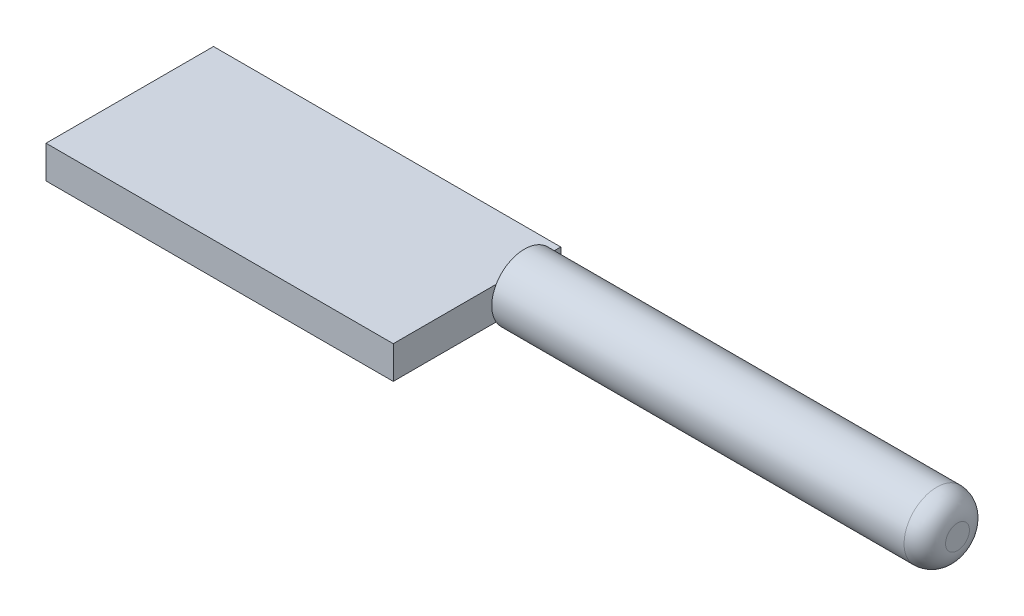
from build123d import *

# Parameters (mm, degrees)
SKETCH1_W           = 42.5
SKETCH1_H           = 20.5
BOSS_EXTRUDE1_DEPTH = 4
SKETCH2_R           = 4
BOSS_EXTRUDE2_DEPTH = 53
FILLET1_R           = 2.54


with BuildPart() as part:
    # Sketch1 → Boss-Extrude1 (new body)
    with BuildSketch(Plane(origin=(0, 0, 0), x_dir=(1, 0, 0), z_dir=(0, 1, 0))):
        Rectangle(SKETCH1_W, SKETCH1_H)
    extrude(amount=BOSS_EXTRUDE1_DEPTH)

    # Sketch2 → Boss-Extrude2 (add)
    with BuildSketch(Plane(origin=(21.25, 0, 0), x_dir=(0, 0, -1), z_dir=(1, 0, 0))):
        with Locations((5.804410425, 2)):
            Circle(SKETCH2_R)
    extrude(amount=BOSS_EXTRUDE2_DEPTH)

    # Fillet1
    fillet1_edges = [part.edges().sort_by_distance(p)[0] for p in [
        (74.25, 2, -1.804410425),
    ]]
    fillet(fillet1_edges, radius=FILLET1_R)


solid = part.part
